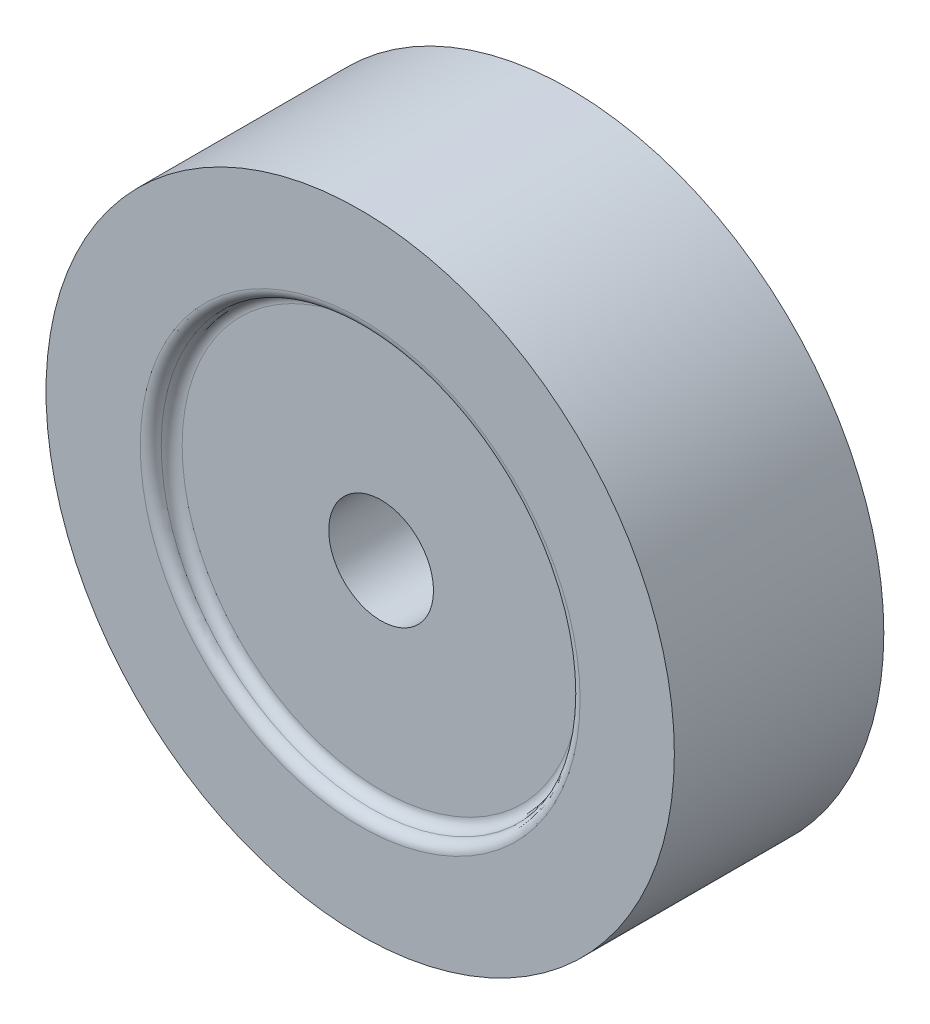
from build123d import *

# Parameters (mm, degrees)
SKETCH1_R           = 30
BOSS_EXTRUDE1_DEPTH = 10
SKETCH2_R           = 20
CUT_EXTRUDE1_DEPTH  = 2
FILLET1_R           = 1
CUT_EXTRUDE2_REACH  = 48.087
SKETCH3_R           = 5


with BuildPart() as part:
    # Sketch1 → Boss-Extrude1 (new, symmetric)
    with BuildSketch(Plane.XY):
        Circle(SKETCH1_R)
    extrude(amount=BOSS_EXTRUDE1_DEPTH, both=True)

    # Sketch2 → Cut-Extrude1 (cut)
    with BuildSketch(Plane.XY.offset(10)):
        Circle(SKETCH2_R)
    cut_extrude1 = extrude(amount=-CUT_EXTRUDE1_DEPTH, mode=Mode.SUBTRACT)

    # Mirror1: Cut-Extrude1 across plane
    add(cut_extrude1.mirror(Plane.XY), mode=Mode.SUBTRACT)

    # Fillet1
    fillet1_edges = [part.edges().sort_by_distance(p)[0] for p in [
        (-20, 0, -10),
        (-20, 0, -8),
        (-20, 0, 8),
        (-20, 0, 10),
    ]]
    fillet(fillet1_edges, radius=FILLET1_R - 0.0001)  # a hair under: the kernel refuses the full size

    # Sketch3 → Cut-Extrude2 (cut, up to next)
    with BuildSketch(Plane.XY.offset(8), mode=Mode.PRIVATE) as cut_extrude2_sk1:
        Circle(SKETCH3_R)
    cut_extrude2_tool1 = extrude(cut_extrude2_sk1.sketch, amount=-CUT_EXTRUDE2_REACH, mode=Mode.PRIVATE) & part.part
    add(cut_extrude2_tool1.solids().sort_by_distance((0, 0, 8))[0], mode=Mode.SUBTRACT)


solid = part.part
